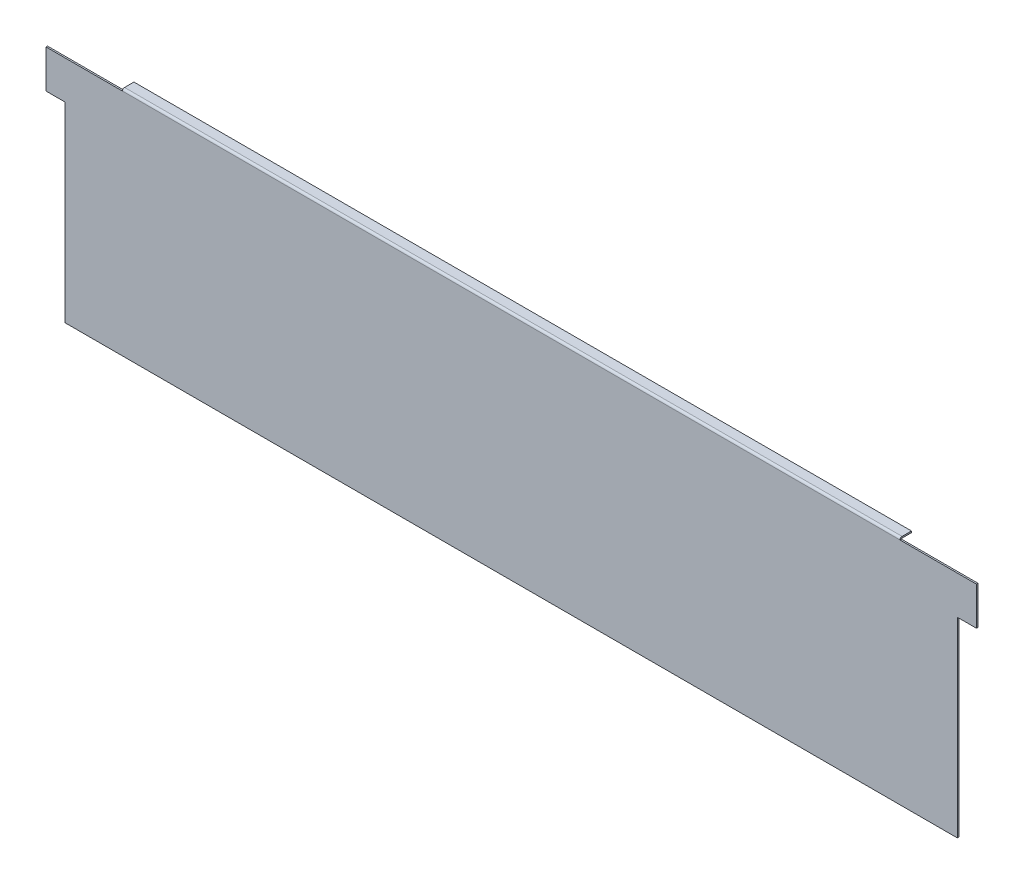
from build123d import *

# Parameters (mm, degrees)
BASE_FLANGE1_DEPTH = 2
EDGE_FLANGE1_DEPTH = 1017


# Sheet-metal steps are written as plain solids
with BuildPart() as part:
    # Sketch1 → Base-Flange1 (new body)
    with BuildSketch(Plane.XY):
        Polygon((960.416808149, 91.455857385), (985.416808149, 91.455857385), (985.416808149, 141.455857385), (-231.583191851, 141.455857385), (-231.583191851, 91.455857385), (-206.583191851, 91.455857385), (-206.583191851, -158.544142615), (960.416808149, -158.544142615), align=None)
    extrude(amount=-BASE_FLANGE1_DEPTH)

    # Edge-Flange1 section (across the edge) → Edge-Flange1 (add)
    with BuildSketch(Plane(origin=(-131.583191851, 142.192457385, -2), x_dir=(0, -1, 0), z_dir=(1, 0, 0))):
        with BuildLine():
            Line((-2, 0.7366), (-2, 13))
            Line((-2, 13), (0, 13))
            Line((0, 13), (0, 0.7366))
            ThreePointArc((0, 0.7366), (0.215745145, 0.215745145), (0.7366, 0))
            Line((0.7366, 0), (0.7366, -2))
            ThreePointArc((0.7366, -2), (-1.198468417, -1.198468417), (-2, 0.7366))
        make_face()
    extrude(amount=EDGE_FLANGE1_DEPTH)


solid = part.part
